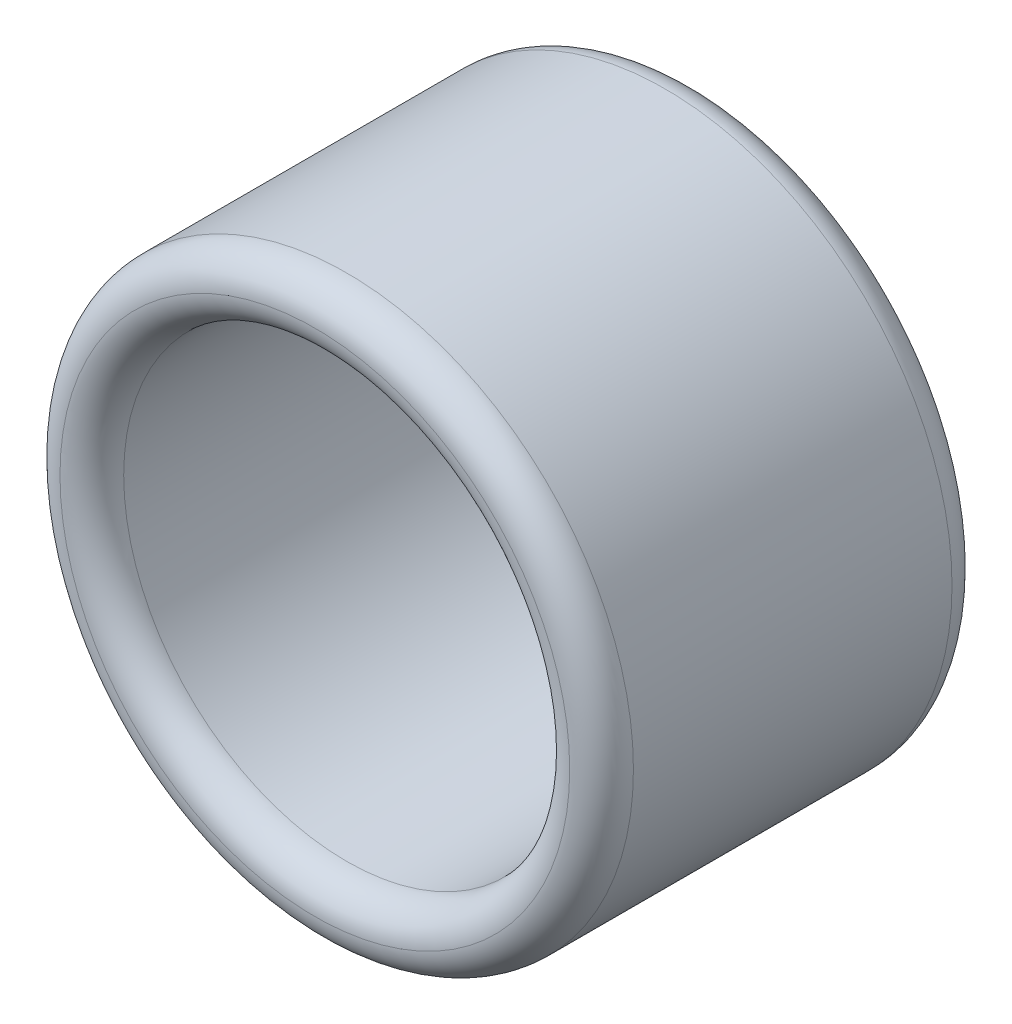
from build123d import *

# Parameters (mm, degrees)
SKETCH1_R           = 4.5
SKETCH1_R_2         = 3.5
BOSS_EXTRUDE1_DEPTH = 6
FILLET1_R           = 0.5


with BuildPart() as part:
    # Sketch1 → Boss-Extrude1 (new body)
    with BuildSketch(Plane.XY):
        with Locations((-54.906305706, 0)):
            Circle(SKETCH1_R)
        with Locations((-54.906305706, 0)):
            Circle(SKETCH1_R_2, mode=Mode.SUBTRACT)
    extrude(amount=BOSS_EXTRUDE1_DEPTH)

    # Fillet1
    fillet1_edges = [part.edges().sort_by_distance(p)[0] for p in [
        (-59.406305706, 0, 0),
        (-59.406305706, 0, 6),
        (-58.406305706, 0, 0),
        (-58.406305706, 0, 6),
    ]]
    fillet(fillet1_edges, radius=FILLET1_R - 0.0001)  # a hair under: the kernel refuses the full size


solid = part.part
